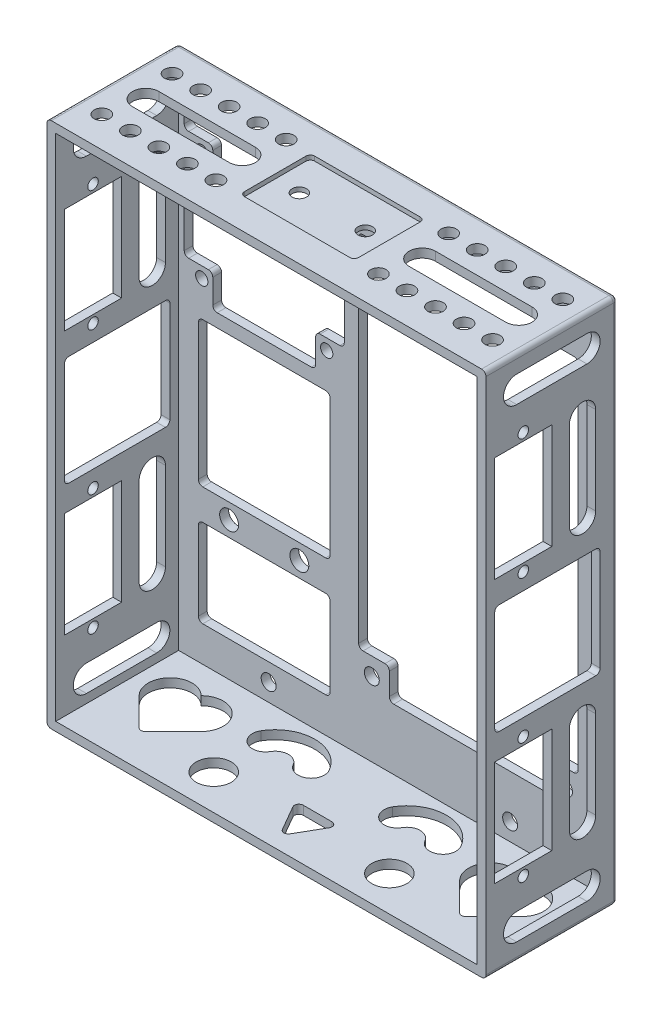
from build123d import *

# Parameters (mm, degrees)
EXTRUDE_1_DEPTH      = 30
SHELL_1_T            = -2
SKETCH_2_R           = 1.7
CUT_EXTRUDE_1_DEPTH  = 30
SKETCH_3_R           = 2.15
SKETCH_3_W           = 30
SKETCH_3_H           = 20
SKETCH_3_H_2         = 33
CUT_EXTRUDE_2_DEPTH  = 10
SKETCH_4_R           = 1.2
SKETCH_4_W           = 13
SKETCH_4_H           = 24
CUT_EXTRUDE_3_DEPTH  = 160.059737206
CUT_EXTRUDE_4_DEPTH  = 159.694675399
SKETCH_7_W           = 26
SKETCH_7_H           = 16
CUT_EXTRUDE_5_DEPTH  = 1
SKETCH_8_R           = 1.65
CUT_EXTRUDE_6_DEPTH  = 1
FILLET_1_R           = 1
SKETCH_9_R           = 1.7
CUT_EXTRUDE_7_DEPTH  = 3
CUT_EXTRUDE_8_DEPTH  = 3
CUT_EXTRUDE_9_DEPTH  = 3
SKETCH_13_R          = 4
CUT_EXTRUDE_10_DEPTH = 3
FILLET_2_R           = 1
CUT_EXTRUDE_11_DEPTH = 160.059737206
CUT_EXTRUDE_12_REACH = 161.06
SKETCH_15_R          = 1.75
CUT_EXTRUDE_13_DEPTH = 160.059737206
FILLET_4_R           = 1
FILLET_5_R           = 1
FILLET_6_R           = 1
CUT_EXTRUDE_14_DEPTH = 160.059737206
SKETCH_18_R          = 1.4
CUT_EXTRUDE_15_DEPTH = 10
CUT_EXTRUDE_16_DEPTH = 10
FILLET_7_R           = 1


with BuildPart() as part:
    # 草图1 → 凸台-拉伸1 (new body)
    with BuildSketch(Plane.XY):
        Polygon((50, 0), (0, 0), (0, 120), (100, 120), (100, 0), align=None)
    extrude(amount=EXTRUDE_1_DEPTH)

    # 抽壳1
    shell_1_openings = [part.faces().sort_by_distance(p)[0] for p in [
        (50, 60, 30),
    ]]
    offset(amount=SHELL_1_T, openings=shell_1_openings, kind=Kind.INTERSECTION)

    # 草图2 → 切除-拉伸1 (cut)
    with BuildSketch(Plane(origin=(0, 0, 0), x_dir=(-1, 0, 0), z_dir=(0, 0, -1))):
        with Locations((-90, 18.9)):
            Circle(SKETCH_2_R)
        with Locations((-90, 109)):
            Circle(SKETCH_2_R)
        with Locations((-46, 109)):
            Circle(SKETCH_2_R)
        with Locations((-46, 18.9)):
            Circle(SKETCH_2_R)
    extrude(amount=-CUT_EXTRUDE_1_DEPTH, mode=Mode.SUBTRACT)

    # 草图3 → 切除-拉伸2 (cut)
    with BuildSketch(Plane(origin=(0, 0, 0), x_dir=(-1, 0, 0), z_dir=(0, 0, -1))):
        with Locations((-29.5, 33.5)):
            Circle(SKETCH_3_R)
        with Locations((-13.5, 33.5)):
            Circle(SKETCH_3_R)
        with Locations((-21.5, 20)):
            Rectangle(SKETCH_3_W, SKETCH_3_H)
        with Locations((-21.5, 53.5)):
            Rectangle(SKETCH_3_W, SKETCH_3_H_2)
    extrude(amount=-CUT_EXTRUDE_2_DEPTH, mode=Mode.SUBTRACT)

    # 草图4 → 切除-拉伸3 (cut, through all)
    with BuildSketch(Plane.ZY):
        with Locations((21.5, 16.25)):
            Circle(SKETCH_4_R)
        with Locations((21.5, 43.75)):
            Circle(SKETCH_4_R)
        with Locations((21.5, 76.25)):
            Circle(SKETCH_4_R)
        with Locations((21.5, 103.75)):
            Circle(SKETCH_4_R)
        with Locations((21.5, 30)):
            Rectangle(SKETCH_4_W, SKETCH_4_H)
        with Locations((21.5, 90)):
            Rectangle(SKETCH_4_W, SKETCH_4_H)
    extrude(amount=-CUT_EXTRUDE_3_DEPTH, mode=Mode.SUBTRACT)

    # 草图6 → 切除-拉伸4 (cut, through all)
    with BuildSketch(Plane.XY.offset(2)):
        Polygon((43, 105), (50, 105), (50, 112), (86, 112), (86, 105), (93, 105), (93, 22.9), (86, 22.9), (86, 15.9), (50, 15.9), (50, 22.9), (43, 22.9), align=None)
    extrude(amount=-CUT_EXTRUDE_4_DEPTH, mode=Mode.SUBTRACT)

    # 草图7 → 切除-拉伸5 (cut)
    with BuildSketch(Plane(origin=(0, 120, 0), x_dir=(1, 0, 0), z_dir=(0, 1, 0))):
        with Locations((50, -15)):
            Rectangle(SKETCH_7_W, SKETCH_7_H)
    extrude(amount=-CUT_EXTRUDE_5_DEPTH, mode=Mode.SUBTRACT)

    # 草图8 → 切除-拉伸6 (cut)
    with BuildSketch(Plane(origin=(0, 119, 0), x_dir=(1, 0, 0), z_dir=(0, 1, 0))):
        with Locations((42.5, -15)):
            Circle(SKETCH_8_R)
        with Locations((57.5, -15)):
            Circle(SKETCH_8_R)
    extrude(amount=-CUT_EXTRUDE_6_DEPTH, mode=Mode.SUBTRACT)

    # 圆角1
    fillet_1_edges = [part.edges().sort_by_distance(p)[0] for p in [
        (63, 119.5, 23),
        (37, 119.5, 23),
        (63, 119.5, 7),
        (37, 119.5, 7),
    ]]
    fillet(fillet_1_edges, radius=FILLET_1_R)

    # 草图9 → 切除-拉伸7 (cut)
    with BuildSketch(Plane(origin=(0, 0, 0), x_dir=(-1, 0, 0), z_dir=(0, 0, -1))):
        with Locations((-77.5, 6)):
            Circle(SKETCH_9_R)
        with Locations((-22.5, 6)):
            Circle(SKETCH_9_R)
    extrude(amount=-CUT_EXTRUDE_7_DEPTH, mode=Mode.SUBTRACT)

    # 草图11 → 切除-拉伸8 (cut)
    with BuildSketch(Plane.XZ):
        Polygon((50, 27), (45, 18.339745962), (55, 18.339745962), align=None)
        with BuildLine():
            ThreePointArc((27.205771366, 8.5), (35, 4), (42.794228634, 8.5))
            ThreePointArc((42.794228634, 8.5), (41.696152423, 12.598076211), (37.598076211, 11.5))
            ThreePointArc((37.598076211, 11.5), (35, 10), (32.401923789, 11.5))
            ThreePointArc((32.401923789, 11.5), (28.303847577, 12.598076211), (27.205771366, 8.5))
        make_face()
        with BuildLine():
            ThreePointArc((72.794228634, 8.5), (65, 4), (57.205771366, 8.5))
            ThreePointArc((57.205771366, 8.5), (58.303847577, 12.598076211), (62.401923789, 11.5))
            ThreePointArc((62.401923789, 11.5), (65, 10), (67.598076211, 11.5))
            ThreePointArc((67.598076211, 11.5), (71.696152423, 12.598076211), (72.794228634, 8.5))
        make_face()
    extrude(amount=-CUT_EXTRUDE_8_DEPTH, mode=Mode.SUBTRACT)

    # 草图12 → 切除-拉伸9 (cut)
    with BuildSketch(Plane.XZ):
        with BuildLine():
            Line((20.571067812, 15.428932188), (13.5, 22.5))
            Line((13.5, 22.5), (6.428932188, 15.428932188))
            ThreePointArc((6.428932188, 15.428932188), (6.428932188, 8.357864376), (13.5, 8.357864376))
            ThreePointArc((13.5, 8.357864376), (20.571067812, 8.357864376), (20.571067812, 15.428932188))
        make_face()
        with BuildLine():
            Line((86.5, 22.5), (93.571067812, 15.428932188))
            ThreePointArc((93.571067812, 15.428932188), (93.571067812, 8.357864376), (86.5, 8.357864376))
            ThreePointArc((86.5, 8.357864376), (79.428932188, 8.357864376), (79.428932188, 15.428932188))
            Line((79.428932188, 15.428932188), (86.5, 22.5))
        make_face()
    extrude(amount=-CUT_EXTRUDE_9_DEPTH, mode=Mode.SUBTRACT)

    # 草图13 → 切除-拉伸10 (cut)
    with BuildSketch(Plane.XZ):
        with Locations((30, 22)):
            Circle(SKETCH_13_R)
        with Locations((70, 22)):
            Circle(SKETCH_13_R)
    extrude(amount=-CUT_EXTRUDE_10_DEPTH, mode=Mode.SUBTRACT)

    # 圆角2
    fillet_2_edges = [part.edges().sort_by_distance(p)[0] for p in [
        (13.5, 1, 22.5),
        (50, 1, 27),
        (45, 1, 18.339745962),
        (55, 1, 18.339745962),
        (86.5, 1, 22.5),
    ]]
    fillet(fillet_2_edges, radius=FILLET_2_R)

    # 草图14 → 切除-拉伸11 (cut, through all)
    with BuildSketch(Plane.ZY):
        with BuildLine():
            Line((5, 47.5), (27, 47.5))
            ThreePointArc((27, 47.5), (27.707106781, 47.792893219), (28, 48.5))
            Line((28, 48.5), (28, 71.5))
            ThreePointArc((28, 71.5), (27.707106781, 72.207106781), (27, 72.5))
            Line((27, 72.5), (5, 72.5))
            ThreePointArc((5, 72.5), (4.292893219, 72.207106781), (4, 71.5))
            Line((4, 71.5), (4, 48.5))
            ThreePointArc((4, 48.5), (4.292893219, 47.792893219), (5, 47.5))
        make_face()
    extrude(amount=-CUT_EXTRUDE_11_DEPTH, mode=Mode.SUBTRACT)

    # 草图15 → 切除-拉伸12 (cut, up to next)
    with BuildSketch(Plane(origin=(0, 120, 0), x_dir=(1, 0, 0), z_dir=(0, 1, 0)), mode=Mode.PRIVATE) as cut_extrude_12_sk1:
        with Locations((5.5, -7)):
            Circle(SKETCH_15_R)
    cut_extrude_12_tool1 = extrude(cut_extrude_12_sk1.sketch, amount=-CUT_EXTRUDE_12_REACH, mode=Mode.PRIVATE) & part.part
    # 草图15 → 切除-拉伸12 (cut, up to next)
    with BuildSketch(Plane(origin=(0, 120, 0), x_dir=(1, 0, 0), z_dir=(0, 1, 0)), mode=Mode.PRIVATE) as cut_extrude_12_sk2:
        with Locations((12, -7)):
            Circle(SKETCH_15_R)
    cut_extrude_12_tool2 = extrude(cut_extrude_12_sk2.sketch, amount=-CUT_EXTRUDE_12_REACH, mode=Mode.PRIVATE) & part.part
    # 草图15 → 切除-拉伸12 (cut, up to next)
    with BuildSketch(Plane(origin=(0, 120, 0), x_dir=(1, 0, 0), z_dir=(0, 1, 0)), mode=Mode.PRIVATE) as cut_extrude_12_sk3:
        with Locations((18.5, -7)):
            Circle(SKETCH_15_R)
    cut_extrude_12_tool3 = extrude(cut_extrude_12_sk3.sketch, amount=-CUT_EXTRUDE_12_REACH, mode=Mode.PRIVATE) & part.part
    # 草图15 → 切除-拉伸12 (cut, up to next)
    with BuildSketch(Plane(origin=(0, 120, 0), x_dir=(1, 0, 0), z_dir=(0, 1, 0)), mode=Mode.PRIVATE) as cut_extrude_12_sk4:
        with Locations((25, -7)):
            Circle(SKETCH_15_R)
    cut_extrude_12_tool4 = extrude(cut_extrude_12_sk4.sketch, amount=-CUT_EXTRUDE_12_REACH, mode=Mode.PRIVATE) & part.part
    # 草图15 → 切除-拉伸12 (cut, up to next)
    with BuildSketch(Plane(origin=(0, 120, 0), x_dir=(1, 0, 0), z_dir=(0, 1, 0)), mode=Mode.PRIVATE) as cut_extrude_12_sk5:
        with Locations((31.5, -7)):
            Circle(SKETCH_15_R)
    cut_extrude_12_tool5 = extrude(cut_extrude_12_sk5.sketch, amount=-CUT_EXTRUDE_12_REACH, mode=Mode.PRIVATE) & part.part
    # 草图15 → 切除-拉伸12 (cut, up to next)
    with BuildSketch(Plane(origin=(0, 120, 0), x_dir=(1, 0, 0), z_dir=(0, 1, 0)), mode=Mode.PRIVATE) as cut_extrude_12_sk6:
        with Locations((31.5, -23)):
            Circle(SKETCH_15_R)
    cut_extrude_12_tool6 = extrude(cut_extrude_12_sk6.sketch, amount=-CUT_EXTRUDE_12_REACH, mode=Mode.PRIVATE) & part.part
    # 草图15 → 切除-拉伸12 (cut, up to next)
    with BuildSketch(Plane(origin=(0, 120, 0), x_dir=(1, 0, 0), z_dir=(0, 1, 0)), mode=Mode.PRIVATE) as cut_extrude_12_sk7:
        with Locations((25, -23)):
            Circle(SKETCH_15_R)
    cut_extrude_12_tool7 = extrude(cut_extrude_12_sk7.sketch, amount=-CUT_EXTRUDE_12_REACH, mode=Mode.PRIVATE) & part.part
    # 草图15 → 切除-拉伸12 (cut, up to next)
    with BuildSketch(Plane(origin=(0, 120, 0), x_dir=(1, 0, 0), z_dir=(0, 1, 0)), mode=Mode.PRIVATE) as cut_extrude_12_sk8:
        with Locations((18.5, -23)):
            Circle(SKETCH_15_R)
    cut_extrude_12_tool8 = extrude(cut_extrude_12_sk8.sketch, amount=-CUT_EXTRUDE_12_REACH, mode=Mode.PRIVATE) & part.part
    # 草图15 → 切除-拉伸12 (cut, up to next)
    with BuildSketch(Plane(origin=(0, 120, 0), x_dir=(1, 0, 0), z_dir=(0, 1, 0)), mode=Mode.PRIVATE) as cut_extrude_12_sk9:
        with Locations((12, -23)):
            Circle(SKETCH_15_R)
    cut_extrude_12_tool9 = extrude(cut_extrude_12_sk9.sketch, amount=-CUT_EXTRUDE_12_REACH, mode=Mode.PRIVATE) & part.part
    # 草图15 → 切除-拉伸12 (cut, up to next)
    with BuildSketch(Plane(origin=(0, 120, 0), x_dir=(1, 0, 0), z_dir=(0, 1, 0)), mode=Mode.PRIVATE) as cut_extrude_12_sk10:
        with Locations((5.5, -23)):
            Circle(SKETCH_15_R)
    cut_extrude_12_tool10 = extrude(cut_extrude_12_sk10.sketch, amount=-CUT_EXTRUDE_12_REACH, mode=Mode.PRIVATE) & part.part
    # 草图15 → 切除-拉伸12 (cut, up to next)
    with BuildSketch(Plane(origin=(0, 120, 0), x_dir=(1, 0, 0), z_dir=(0, 1, 0)), mode=Mode.PRIVATE) as cut_extrude_12_sk11:
        with Locations((94.5, -23)):
            Circle(SKETCH_15_R)
    cut_extrude_12_tool11 = extrude(cut_extrude_12_sk11.sketch, amount=-CUT_EXTRUDE_12_REACH, mode=Mode.PRIVATE) & part.part
    # 草图15 → 切除-拉伸12 (cut, up to next)
    with BuildSketch(Plane(origin=(0, 120, 0), x_dir=(1, 0, 0), z_dir=(0, 1, 0)), mode=Mode.PRIVATE) as cut_extrude_12_sk12:
        with Locations((88, -23)):
            Circle(SKETCH_15_R)
    cut_extrude_12_tool12 = extrude(cut_extrude_12_sk12.sketch, amount=-CUT_EXTRUDE_12_REACH, mode=Mode.PRIVATE) & part.part
    # 草图15 → 切除-拉伸12 (cut, up to next)
    with BuildSketch(Plane(origin=(0, 120, 0), x_dir=(1, 0, 0), z_dir=(0, 1, 0)), mode=Mode.PRIVATE) as cut_extrude_12_sk13:
        with Locations((81.5, -23)):
            Circle(SKETCH_15_R)
    cut_extrude_12_tool13 = extrude(cut_extrude_12_sk13.sketch, amount=-CUT_EXTRUDE_12_REACH, mode=Mode.PRIVATE) & part.part
    # 草图15 → 切除-拉伸12 (cut, up to next)
    with BuildSketch(Plane(origin=(0, 120, 0), x_dir=(1, 0, 0), z_dir=(0, 1, 0)), mode=Mode.PRIVATE) as cut_extrude_12_sk14:
        with Locations((75, -23)):
            Circle(SKETCH_15_R)
    cut_extrude_12_tool14 = extrude(cut_extrude_12_sk14.sketch, amount=-CUT_EXTRUDE_12_REACH, mode=Mode.PRIVATE) & part.part
    # 草图15 → 切除-拉伸12 (cut, up to next)
    with BuildSketch(Plane(origin=(0, 120, 0), x_dir=(1, 0, 0), z_dir=(0, 1, 0)), mode=Mode.PRIVATE) as cut_extrude_12_sk15:
        with Locations((68.5, -23)):
            Circle(SKETCH_15_R)
    cut_extrude_12_tool15 = extrude(cut_extrude_12_sk15.sketch, amount=-CUT_EXTRUDE_12_REACH, mode=Mode.PRIVATE) & part.part
    # 草图15 → 切除-拉伸12 (cut, up to next)
    with BuildSketch(Plane(origin=(0, 120, 0), x_dir=(1, 0, 0), z_dir=(0, 1, 0)), mode=Mode.PRIVATE) as cut_extrude_12_sk16:
        with Locations((68.5, -7)):
            Circle(SKETCH_15_R)
    cut_extrude_12_tool16 = extrude(cut_extrude_12_sk16.sketch, amount=-CUT_EXTRUDE_12_REACH, mode=Mode.PRIVATE) & part.part
    # 草图15 → 切除-拉伸12 (cut, up to next)
    with BuildSketch(Plane(origin=(0, 120, 0), x_dir=(1, 0, 0), z_dir=(0, 1, 0)), mode=Mode.PRIVATE) as cut_extrude_12_sk17:
        with Locations((75, -7)):
            Circle(SKETCH_15_R)
    cut_extrude_12_tool17 = extrude(cut_extrude_12_sk17.sketch, amount=-CUT_EXTRUDE_12_REACH, mode=Mode.PRIVATE) & part.part
    # 草图15 → 切除-拉伸12 (cut, up to next)
    with BuildSketch(Plane(origin=(0, 120, 0), x_dir=(1, 0, 0), z_dir=(0, 1, 0)), mode=Mode.PRIVATE) as cut_extrude_12_sk18:
        with Locations((81.5, -7)):
            Circle(SKETCH_15_R)
    cut_extrude_12_tool18 = extrude(cut_extrude_12_sk18.sketch, amount=-CUT_EXTRUDE_12_REACH, mode=Mode.PRIVATE) & part.part
    # 草图15 → 切除-拉伸12 (cut, up to next)
    with BuildSketch(Plane(origin=(0, 120, 0), x_dir=(1, 0, 0), z_dir=(0, 1, 0)), mode=Mode.PRIVATE) as cut_extrude_12_sk19:
        with Locations((88, -7)):
            Circle(SKETCH_15_R)
    cut_extrude_12_tool19 = extrude(cut_extrude_12_sk19.sketch, amount=-CUT_EXTRUDE_12_REACH, mode=Mode.PRIVATE) & part.part
    # 草图15 → 切除-拉伸12 (cut, up to next)
    with BuildSketch(Plane(origin=(0, 120, 0), x_dir=(1, 0, 0), z_dir=(0, 1, 0)), mode=Mode.PRIVATE) as cut_extrude_12_sk20:
        with Locations((94.5, -7)):
            Circle(SKETCH_15_R)
    cut_extrude_12_tool20 = extrude(cut_extrude_12_sk20.sketch, amount=-CUT_EXTRUDE_12_REACH, mode=Mode.PRIVATE) & part.part
    # 草图15 → 切除-拉伸12 (cut, up to next)
    with BuildSketch(Plane(origin=(0, 120, 0), x_dir=(1, 0, 0), z_dir=(0, 1, 0)), mode=Mode.PRIVATE) as cut_extrude_12_sk21:
        with BuildLine():
            Line((7.5, -12), (29.5, -12))
            ThreePointArc((29.5, -12), (32.5, -15), (29.5, -18))
            Line((29.5, -18), (7.5, -18))
            ThreePointArc((7.5, -18), (4.5, -15), (7.5, -12))
        make_face()
    cut_extrude_12_tool21 = extrude(cut_extrude_12_sk21.sketch, amount=-CUT_EXTRUDE_12_REACH, mode=Mode.PRIVATE) & part.part
    # 草图15 → 切除-拉伸12 (cut, up to next)
    with BuildSketch(Plane(origin=(0, 120, 0), x_dir=(1, 0, 0), z_dir=(0, 1, 0)), mode=Mode.PRIVATE) as cut_extrude_12_sk22:
        with BuildLine():
            Line((92.5, -12), (70.5, -12))
            ThreePointArc((70.5, -12), (67.5, -15), (70.5, -18))
            Line((70.5, -18), (92.5, -18))
            ThreePointArc((92.5, -18), (95.5, -15), (92.5, -12))
        make_face()
    cut_extrude_12_tool22 = extrude(cut_extrude_12_sk22.sketch, amount=-CUT_EXTRUDE_12_REACH, mode=Mode.PRIVATE) & part.part
    add(cut_extrude_12_tool1.solids().sort_by_distance((5.5, 120, 7))[0], mode=Mode.SUBTRACT)
    add(cut_extrude_12_tool2.solids().sort_by_distance((12, 120, 7))[0], mode=Mode.SUBTRACT)
    add(cut_extrude_12_tool3.solids().sort_by_distance((18.5, 120, 7))[0], mode=Mode.SUBTRACT)
    add(cut_extrude_12_tool4.solids().sort_by_distance((25, 120, 7))[0], mode=Mode.SUBTRACT)
    add(cut_extrude_12_tool5.solids().sort_by_distance((31.5, 120, 7))[0], mode=Mode.SUBTRACT)
    add(cut_extrude_12_tool6.solids().sort_by_distance((31.5, 120, 23))[0], mode=Mode.SUBTRACT)
    add(cut_extrude_12_tool7.solids().sort_by_distance((25, 120, 23))[0], mode=Mode.SUBTRACT)
    add(cut_extrude_12_tool8.solids().sort_by_distance((18.5, 120, 23))[0], mode=Mode.SUBTRACT)
    add(cut_extrude_12_tool9.solids().sort_by_distance((12, 120, 23))[0], mode=Mode.SUBTRACT)
    add(cut_extrude_12_tool10.solids().sort_by_distance((5.5, 120, 23))[0], mode=Mode.SUBTRACT)
    add(cut_extrude_12_tool11.solids().sort_by_distance((94.5, 120, 23))[0], mode=Mode.SUBTRACT)
    add(cut_extrude_12_tool12.solids().sort_by_distance((88, 120, 23))[0], mode=Mode.SUBTRACT)
    add(cut_extrude_12_tool13.solids().sort_by_distance((81.5, 120, 23))[0], mode=Mode.SUBTRACT)
    add(cut_extrude_12_tool14.solids().sort_by_distance((75, 120, 23))[0], mode=Mode.SUBTRACT)
    add(cut_extrude_12_tool15.solids().sort_by_distance((68.5, 120, 23))[0], mode=Mode.SUBTRACT)
    add(cut_extrude_12_tool16.solids().sort_by_distance((68.5, 120, 7))[0], mode=Mode.SUBTRACT)
    add(cut_extrude_12_tool17.solids().sort_by_distance((75, 120, 7))[0], mode=Mode.SUBTRACT)
    add(cut_extrude_12_tool18.solids().sort_by_distance((81.5, 120, 7))[0], mode=Mode.SUBTRACT)
    add(cut_extrude_12_tool19.solids().sort_by_distance((88, 120, 7))[0], mode=Mode.SUBTRACT)
    add(cut_extrude_12_tool20.solids().sort_by_distance((94.5, 120, 7))[0], mode=Mode.SUBTRACT)
    add(cut_extrude_12_tool21.solids().sort_by_distance((18.5, 120, 15))[0], mode=Mode.SUBTRACT)
    add(cut_extrude_12_tool22.solids().sort_by_distance((81.5, 120, 15))[0], mode=Mode.SUBTRACT)

    # 草图16 → 切除-拉伸13 (cut, through all)
    with BuildSketch(Plane.ZY):
        with BuildLine():
            Line((7, 116), (23, 116))
            ThreePointArc((23, 116), (26, 113), (23, 110))
            Line((23, 110), (7, 110))
            ThreePointArc((7, 110), (4, 113), (7, 116))
        make_face()
        with BuildLine():
            Line((7, 4), (23, 4))
            ThreePointArc((23, 4), (26, 7), (23, 10))
            Line((23, 10), (7, 10))
            ThreePointArc((7, 10), (4, 7), (7, 4))
        make_face()
    extrude(amount=-CUT_EXTRUDE_13_DEPTH, mode=Mode.SUBTRACT)

    # 圆角4
    fillet_4_edges = [part.edges().sort_by_distance(p)[0] for p in [
        (50, 112, 1),
        (43, 105, 1),
        (50, 105, 1),
        (43, 22.9, 1),
        (50, 15.9, 1),
        (50, 22.9, 1),
        (86, 112, 1),
        (86, 105, 1),
        (93, 105, 1),
        (86, 15.9, 1),
        (93, 22.9, 1),
        (86, 22.9, 1),
    ]]
    fillet(fillet_4_edges, radius=FILLET_4_R)

    # 圆角5
    fillet_5_edges = [part.edges().sort_by_distance(p)[0] for p in [
        (6.5, 37, 1),
        (36.5, 37, 1),
        (6.5, 70, 1),
        (36.5, 70, 1),
        (6.5, 10, 1),
        (6.5, 30, 1),
        (36.5, 30, 1),
        (36.5, 10, 1),
    ]]
    fillet(fillet_5_edges, radius=FILLET_5_R)

    # 圆角6
    fillet_6_edges = [part.edges().sort_by_distance(p)[0] for p in [
        (100, 120, 15),
        (100, 0, 15),
        (100, 60, 0),
        (0, 120, 15),
        (50, 120, 0),
        (0, 0, 15),
        (50, 0, 0),
        (0, 60, 0),
    ]]
    fillet(fillet_6_edges, radius=FILLET_6_R)

    # 草图17 → 切除-拉伸14 (cut, through all)
    with BuildSketch(Plane.ZY):
        with BuildLine():
            Line((5, 20), (5, 40))
            ThreePointArc((5, 40), (8, 43), (11, 40))
            Line((11, 40), (11, 20))
            ThreePointArc((11, 20), (8, 17), (5, 20))
        make_face()
        with BuildLine():
            Line((5, 100), (5, 80))
            ThreePointArc((5, 80), (8, 77), (11, 80))
            Line((11, 80), (11, 100))
            ThreePointArc((11, 100), (8, 103), (5, 100))
        make_face()
    extrude(amount=-CUT_EXTRUDE_14_DEPTH, mode=Mode.SUBTRACT)

    # 草图18 → 切除-拉伸15 (cut)
    with BuildSketch(Plane(origin=(0, 0, 0), x_dir=(-1, 0, 0), z_dir=(0, 0, -1))):
        with Locations((-35.725, 78)):
            Circle(SKETCH_18_R)
        with Locations((-7.275, 78)):
            Circle(SKETCH_18_R)
        with Locations((-35.725, 103.02)):
            Circle(SKETCH_18_R)
        with Locations((-7.275, 103.02)):
            Circle(SKETCH_18_R)
    extrude(amount=-CUT_EXTRUDE_15_DEPTH, mode=Mode.SUBTRACT)

    # 草图19 → 切除-拉伸16 (cut)
    with BuildSketch(Plane(origin=(0, 0, 0), x_dir=(-1, 0, 0), z_dir=(0, 0, -1))):
        Polygon((-39.725, 100.52), (-39.725, 80.5), (-33.225, 80.5), (-33.225, 73), (-9.775, 73), (-9.775, 80.5), (-3.275, 80.5), (-3.275, 100.52), (-9.775, 100.52), (-9.775, 105.52), (-3.275, 105.52), (-3.275, 115.52), (-39.725, 115.52), (-39.725, 105.52), (-33.225, 105.52), (-33.225, 100.52), align=None)
    extrude(amount=-CUT_EXTRUDE_16_DEPTH, mode=Mode.SUBTRACT)

    # 圆角7
    fillet_7_edges = [part.edges().sort_by_distance(p)[0] for p in [
        (3.275, 105.52, 1),
        (9.775, 105.52, 1),
        (9.775, 100.52, 1),
        (3.275, 100.52, 1),
        (3.275, 80.5, 1),
        (9.775, 80.5, 1),
        (9.775, 73, 1),
        (33.225, 73, 1),
        (33.225, 80.5, 1),
        (39.725, 80.5, 1),
        (39.725, 100.52, 1),
        (33.225, 100.52, 1),
        (33.225, 105.52, 1),
        (39.725, 105.52, 1),
        (3.275, 115.52, 1),
        (39.725, 115.52, 1),
    ]]
    fillet(fillet_7_edges, radius=FILLET_7_R)


solid = part.part
